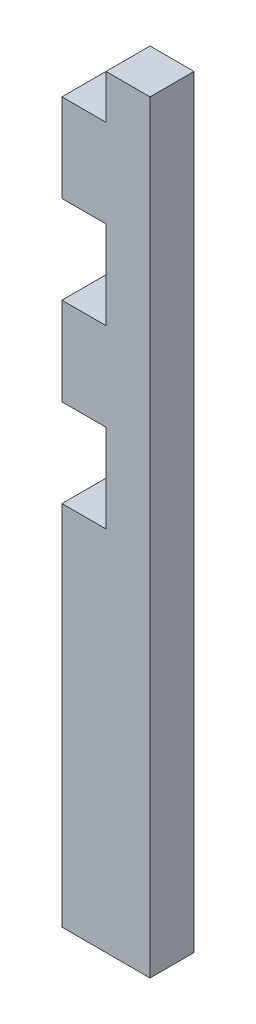
from build123d import *

# Parameters (mm, degrees)
SKETCH1_W           = 12
SKETCH1_H           = 54
BOSS_EXTRUDE4_DEPTH = 6
SKETCH1_8_W         = 12
SKETCH1_8_H         = 50
BOSS_EXTRUDE5_DEPTH = 6
CUT_EXTRUDE1_REACH  = 57.642
SKETCH4_W           = 6
SKETCH4_H           = 12


with BuildPart() as part:
    # Sketch1 → Boss-Extrude4 (new body)
    with BuildSketch(Plane.XY):
        with Locations((6, 27)):
            Rectangle(SKETCH1_W, SKETCH1_H)
    extrude(amount=BOSS_EXTRUDE4_DEPTH)

    # Sketch1<8> → Boss-Extrude5 (add)
    with BuildSketch(Plane.XY):
        with Locations((6, -25)):
            Rectangle(SKETCH1_8_W, SKETCH1_8_H)
    extrude(amount=BOSS_EXTRUDE5_DEPTH)

    # Sketch4 → Cut-Extrude1 (cut, up to next)
    with BuildSketch(Plane(origin=(0, 0, 0), x_dir=(-1, 0, 0), z_dir=(0, 0, -1)), mode=Mode.PRIVATE) as cut_extrude1_sk1:
        with Locations((-3, 54)):
            Rectangle(SKETCH4_W, SKETCH4_H)
    cut_extrude1_tool1 = extrude(cut_extrude1_sk1.sketch, amount=-CUT_EXTRUDE1_REACH, mode=Mode.PRIVATE) & part.part
    # Sketch4 → Cut-Extrude1 (cut, up to next)
    with BuildSketch(Plane(origin=(0, 0, 0), x_dir=(-1, 0, 0), z_dir=(0, 0, -1)), mode=Mode.PRIVATE) as cut_extrude1_sk2:
        with Locations((-3, 30)):
            Rectangle(SKETCH4_W, SKETCH4_H)
    cut_extrude1_tool2 = extrude(cut_extrude1_sk2.sketch, amount=-CUT_EXTRUDE1_REACH, mode=Mode.PRIVATE) & part.part
    # Sketch4 → Cut-Extrude1 (cut, up to next)
    with BuildSketch(Plane(origin=(0, 0, 0), x_dir=(-1, 0, 0), z_dir=(0, 0, -1)), mode=Mode.PRIVATE) as cut_extrude1_sk3:
        with Locations((-3, 6)):
            Rectangle(SKETCH4_W, SKETCH4_H)
    cut_extrude1_tool3 = extrude(cut_extrude1_sk3.sketch, amount=-CUT_EXTRUDE1_REACH, mode=Mode.PRIVATE) & part.part
    add(cut_extrude1_tool1.solids().sort_by_distance((3, 54, 0))[0], mode=Mode.SUBTRACT)
    add(cut_extrude1_tool2.solids().sort_by_distance((3, 30, 0))[0], mode=Mode.SUBTRACT)
    add(cut_extrude1_tool3.solids().sort_by_distance((3, 6, 0))[0], mode=Mode.SUBTRACT)


solid = part.part
